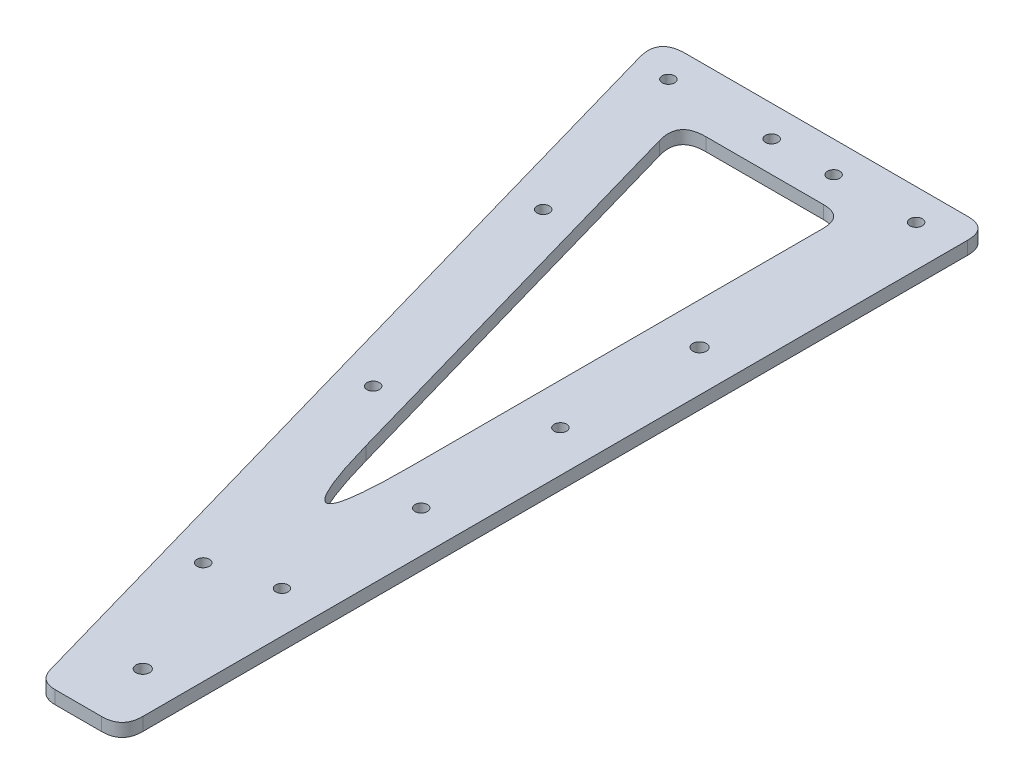
from build123d import *

# Parameters (mm, degrees)
SKETCH1_R           = 1.5
SKETCH1_R_2         = 1.65
BOSS_EXTRUDE1_DEPTH = 3.175
FILLET1_SIZE        = 5


with BuildPart() as part:
    # Sketch1 → Boss-Extrude1 (new body)
    with BuildSketch(Plane(origin=(0, 0, 0), x_dir=(1, 0, 0), z_dir=(0, 1, 0))):
        Polygon((-20, -210), (0, -210), (0, 0), (-80, 0), align=None)
        with Locations(Location((-41.422797756, -107.71979577, 0), (0, 0, 270))):
            Circle(SKETCH1_R, mode=Mode.SUBTRACT)
        with Locations(Location((-24.939530082, -165.411232629, 0), (0, 0, 270))):
            Circle(SKETCH1_R, mode=Mode.SUBTRACT)
        with Locations(Location((-10, -195, 0), (0, 0, 270))):
            Circle(SKETCH1_R_2, mode=Mode.SUBTRACT)
        with BuildLine():
            ThreePointArc((-10, -159.75), (-8.5, -161.25), (-10, -162.75))
            ThreePointArc((-10, -162.75), (-11.5, -161.25), (-10, -159.75))
        make_face(mode=Mode.SUBTRACT)
        with BuildLine():
            ThreePointArc((-10, -126), (-8.5, -127.5), (-10, -129))
            ThreePointArc((-10, -129), (-11.5, -127.5), (-10, -126))
        make_face(mode=Mode.SUBTRACT)
        Polygon((-20, -15), (-20, -155.39917583), (-60.114050237, -15), align=None, mode=Mode.SUBTRACT)
        with Locations(Location((-57.90606543, -50.028358912, 0), (0, 0, 270))):
            Circle(SKETCH1_R, mode=Mode.SUBTRACT)
        with Locations(Location((-70.057025119, -7.5, 0), (0, 0, 270))):
            Circle(SKETCH1_R, mode=Mode.SUBTRACT)
        with Locations(Location((-45.028512559, -7.5, 0), (0, 0, 270))):
            Circle(SKETCH1_R, mode=Mode.SUBTRACT)
        with BuildLine():
            ThreePointArc((-10, -92.25), (-8.5, -93.75), (-10, -95.25))
            ThreePointArc((-10, -95.25), (-11.5, -93.75), (-10, -92.25))
        make_face(mode=Mode.SUBTRACT)
        with Locations(Location((-10, -60, 0), (0, 0, 270))):
            Circle(SKETCH1_R_2, mode=Mode.SUBTRACT)
        with Locations(Location((-30, -7.5, 0), (0, 0, 270))):
            Circle(SKETCH1_R, mode=Mode.SUBTRACT)
        with Locations(Location((-10, -7.5, 0), (0, 0, 270))):
            Circle(SKETCH1_R, mode=Mode.SUBTRACT)
    extrude(amount=BOSS_EXTRUDE1_DEPTH)

    # Fillet1
    # a fillet whose section is not a circle: 5 mm, written as the material it adds along each edge
    with BuildSketch(Plane(origin=(-20, 0, 15), x_dir=(0, 0, 1), z_dir=(0, 1, 0))) as fillet1_piece_1:
        with BuildLine():
            Bezier((FILLET1_SIZE, 0), (0, 0), (0, -FILLET1_SIZE), weights=[1, 1, 1])
            Line((0, -FILLET1_SIZE), (0, 0))
            Line((0, 0), (FILLET1_SIZE, 0))
        make_face()
    extrude(amount=3.175)
    with BuildSketch(Plane(origin=(-60.114050237, 0, 15), x_dir=(0.2747211278973786, 0, 0.9615239476408229), z_dir=(0, 1, 0))) as fillet1_piece_2:
        with BuildLine():
            Bezier((6.628649921, 0), (0, 0), (1.821030183, 6.373605639), weights=[1, 1, 1])
            Line((1.821030183, 6.373605639), (0, 0))
            Line((0, 0), (6.628649921, 0))
        make_face()
    extrude(amount=3.175)
    with BuildSketch(Plane(origin=(-20, 0, 155.39917583), x_dir=(-0.274721127897378, 0, -0.961523947640823), z_dir=(0, 1, 0))) as fillet1_piece_3:
        with BuildLine():
            Bezier((35.700274723, 0), (0, 0), (34.326669084, -9.807619738), weights=[1, 1, 1])
            Line((34.326669084, -9.807619738), (0, 0))
            Line((0, 0), (35.700274723, 0))
        make_face()
    extrude(amount=3.175)
    # a fillet whose section is not a circle: 5 mm, written as the material it takes off along each edge
    with BuildSketch(Plane(origin=(-80, -16.571624802, 0), x_dir=(0.2747211278973785, 0, 0.9615239476408229), z_dir=(0, 1, 0))) as fillet1_2_piece_1:
        with BuildLine():
            Bezier((6.628649921, 0), (0, 0), (1.821030183, 6.373605639), weights=[1, 1, 1])
            Line((1.821030183, 6.373605639), (0, 0))
            Line((0, 0), (6.628649921, 0))
        make_face()
    extrude(amount=36.318249605, mode=Mode.SUBTRACT)
    with BuildSketch(Plane(origin=(0, -12.5, 0), x_dir=(-1, 0, 0), z_dir=(0, 1, 0))) as fillet1_2_piece_2:
        with BuildLine():
            Bezier((FILLET1_SIZE, 0), (0, 0), (0, FILLET1_SIZE), weights=[1, 1, 1])
            Line((0, FILLET1_SIZE), (0, 0))
            Line((0, 0), (FILLET1_SIZE, 0))
        make_face()
    extrude(amount=28.175, mode=Mode.SUBTRACT)
    with BuildSketch(Plane(origin=(0, -12.5, 210), x_dir=(-1, 0, 0), z_dir=(0, 1, 0))) as fillet1_2_piece_3:
        with BuildLine():
            Bezier((FILLET1_SIZE, 0), (0, 0), (0, -FILLET1_SIZE), weights=[1, 1, 1])
            Line((0, -FILLET1_SIZE), (0, 0))
            Line((0, 0), (FILLET1_SIZE, 0))
        make_face()
    extrude(amount=28.175, mode=Mode.SUBTRACT)
    with BuildSketch(Plane(origin=(-20, -9.428767659, 210), x_dir=(-0.2747211278973768, 0, -0.9615239476408235), z_dir=(0, 1, 0))) as fillet1_2_piece_4:
        with BuildLine():
            Bezier((3.771507064, 0), (0, 0), (-1.036112674, -3.626394361), weights=[1, 1, 1])
            Line((-1.036112674, -3.626394361), (0, 0))
            Line((0, 0), (3.771507064, 0))
        make_face()
    extrude(amount=22.032535319, mode=Mode.SUBTRACT)


solid = part.part
